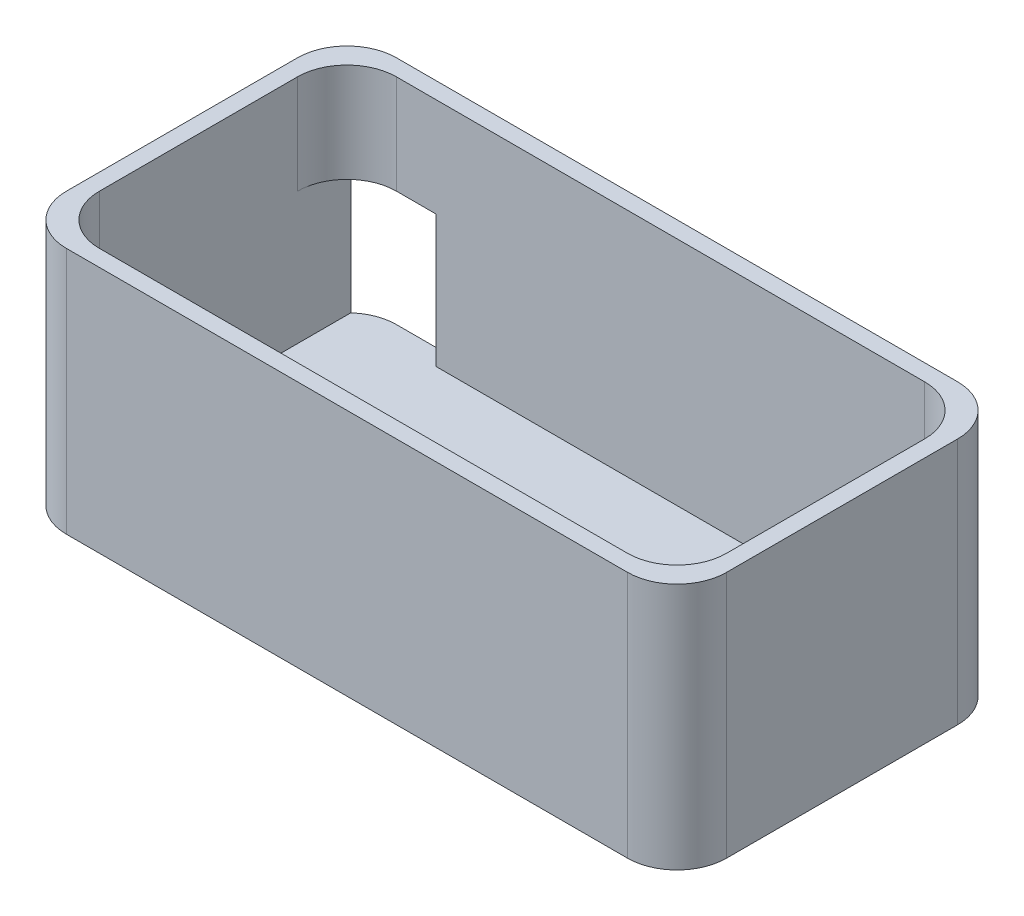
from build123d import *

# Parameters (mm, degrees)
SKETCH1_W           = 200
SKETCH1_H           = 100
BOSS_EXTRUDE1_DEPTH = 5
SKETCH2_W           = 200
SKETCH2_H           = 100
SKETCH2_W_2         = 190
SKETCH2_H_2         = 90
BOSS_EXTRUDE2_DEPTH = 70
SKETCH3_W           = 27
SKETCH3_H           = 40
CUT_EXTRUDE1_DEPTH  = 158.003184681
FILLET1_R           = 15


with BuildPart() as part:
    # Sketch1 → Boss-Extrude1 (new body)
    with BuildSketch(Plane(origin=(0, 0, 0), x_dir=(1, 0, 0), z_dir=(0, 1, 0))):
        Rectangle(SKETCH1_W, SKETCH1_H)
    extrude(amount=BOSS_EXTRUDE1_DEPTH)

    # Sketch2 → Boss-Extrude2 (add)
    with BuildSketch(Plane(origin=(0, 5, 0), x_dir=(1, 0, 0), z_dir=(0, 1, 0))):
        Rectangle(SKETCH2_W, SKETCH2_H)
        Rectangle(SKETCH2_W_2, SKETCH2_H_2, mode=Mode.SUBTRACT)
    extrude(amount=BOSS_EXTRUDE2_DEPTH)

    # Sketch3 → Cut-Extrude1 (cut, through all)
    with BuildSketch(Plane.XY.offset(-45)):
        with Locations((-81.5, 25)):
            Rectangle(SKETCH3_W, SKETCH3_H)
    extrude(amount=-CUT_EXTRUDE1_DEPTH, mode=Mode.SUBTRACT)

    # Fillet1
    # the kernel refuses this fillet: 15 mm, written as the material it adds along each edge
    with BuildSketch(Plane(origin=(95, 5, 45), x_dir=(0, 0, -1), z_dir=(0, 1, 0)), Plane(origin=(95, 5, -45), x_dir=(-1, 0, 0), z_dir=(0, 1, 0)), Plane(origin=(-95, 5, 45), x_dir=(1, 0, 0), z_dir=(0, 1, 0))) as fillet1_piece_1:
        with BuildLine():
            CenterArc((FILLET1_R, FILLET1_R), FILLET1_R, 180, 90)
            Line((0, FILLET1_R), (0, 0))
            Line((0, 0), (FILLET1_R, 0))
        make_face()
    extrude(amount=70)
    with BuildSketch(Plane(origin=(-95, 45, -45), x_dir=(1, 0, 0), z_dir=(0, 1, 0))) as fillet1_piece_2:
        with BuildLine():
            CenterArc((FILLET1_R, -FILLET1_R), FILLET1_R, 90, 90)
            Line((0, -FILLET1_R), (0, 0))
            Line((0, 0), (FILLET1_R, 0))
        make_face()
    extrude(amount=30)
    # the kernel refuses this fillet: 15 mm, written as the material it takes off along each edge
    with BuildSketch(Plane(origin=(100, 112.5, -50), x_dir=(-1, 0, 0), z_dir=(0, -1, 0)), Plane(origin=(-100, -37.5, -50), x_dir=(1, 0, 0), z_dir=(0, 1, 0)), Plane(origin=(100, 112.5, 50), x_dir=(0, 0, -1), z_dir=(0, -1, 0))) as fillet1_2_piece_1:
        with BuildLine():
            CenterArc((FILLET1_R, -FILLET1_R), FILLET1_R, 90, 90)
            Line((0, -FILLET1_R), (0, 0))
            Line((0, 0), (FILLET1_R, 0))
        make_face()
    extrude(amount=150, mode=Mode.SUBTRACT)
    with BuildSketch(Plane(origin=(-100, -37.5, 50), x_dir=(1, 0, 0), z_dir=(0, 1, 0))) as fillet1_2_piece_2:
        with BuildLine():
            CenterArc((FILLET1_R, FILLET1_R), FILLET1_R, 180, 90)
            Line((0, FILLET1_R), (0, 0))
            Line((0, 0), (FILLET1_R, 0))
        make_face()
    extrude(amount=150, mode=Mode.SUBTRACT)


solid = part.part
